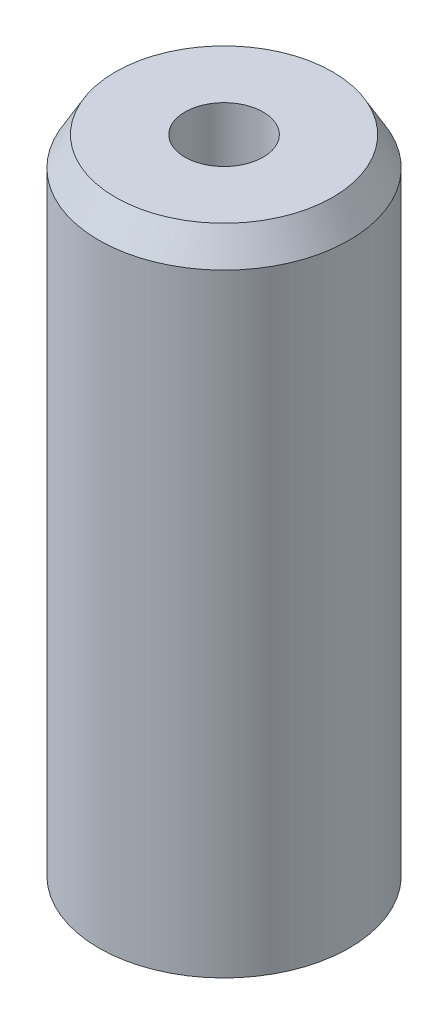
from build123d import *
from OCP.BRepFilletAPI import BRepFilletAPI_MakeChamfer

# Parameters (mm, degrees)
SKETCH1_R           = 12.5
BOSS_EXTRUDE1_DEPTH = 65.697514528
SKETCH2_R           = 3.905234504
CUT_EXTRUDE1_DEPTH  = 69.034281176
CHAMFER1_SIZE       = 2.876183115
CHAMFER1_SIZE2      = 1.660565096


with BuildPart() as part:
    # Sketch1 → Boss-Extrude1 (new body)
    with BuildSketch(Plane(origin=(0, 0, 0), x_dir=(1, 0, 0), z_dir=(0, 1, 0))):
        Circle(SKETCH1_R)
    extrude(amount=BOSS_EXTRUDE1_DEPTH)

    # Sketch2 → Cut-Extrude1 (cut, through all)
    with BuildSketch(Plane(origin=(0, 0, 0), x_dir=(1, 0, 0), z_dir=(0, 1, 0))):
        Circle(SKETCH2_R)
    extrude(amount=CUT_EXTRUDE1_DEPTH, mode=Mode.SUBTRACT)

    # Chamfer1: one chamfer whose edges measure the first distance from different faces: ONE call of the kernel's chamfer builder (chamfer() names one face for all edges)
    chamfer1_edges_1 = [part.edges().sort_by_distance(p)[0] for p in [
        (-12.5, 65.697514528, 0),
    ]]
    chamfer1_side_1 = [part.faces().sort_by_distance(p)[0] for p in [
        (-12.5, 32.848757264, 0),
    ]]
    chamfer1_edges_2 = [part.edges().sort_by_distance(p)[0] for p in [
        (-12.5, 0, 0),
    ]]
    chamfer1_side_2 = [part.faces().sort_by_distance(p)[0] for p in [
        (-12.146446609, 0, 0),
    ]]
    chamfer1 = BRepFilletAPI_MakeChamfer(part.part.solid().wrapped)
    for e in chamfer1_edges_1:
        chamfer1.Add(CHAMFER1_SIZE, CHAMFER1_SIZE2, e.wrapped, chamfer1_side_1[0].wrapped)  # the first distance lies on this face
    for e in chamfer1_edges_2:
        chamfer1.Add(CHAMFER1_SIZE, CHAMFER1_SIZE2, e.wrapped, chamfer1_side_2[0].wrapped)  # the first distance lies on this face
    add(Compound.cast(chamfer1.Shape()), mode=Mode.REPLACE)


solid = part.part
